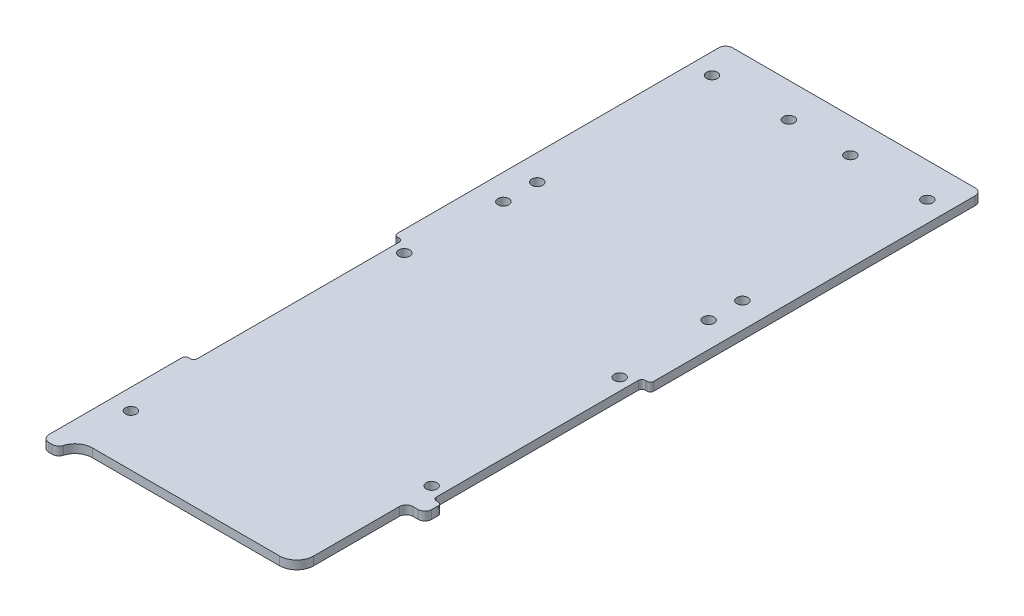
from build123d import *

# Parameters (mm, degrees)
SKETCH1_R               = 2.032
BOSS_EXTRUDE1_DEPTH     = 3.175
FILLET1_R               = 2.54
FILLET2_R               = 2.54
FILLET3_R               = 6.35
CUT_EXTRUDE1_DEPTH      = 136.673215063
FILLET4_R               = 6.35
FILLET5_R               = 2.54
SKETCH3_R               = 2.032
CUT_EXTRUDE2_DEPTH      = 136.673215063
CUT_EXTRUDE3_DEPTH      = 136.673215063
CUT_EXTRUDE3_DEPTH_BACK = 136.673215063
SKETCH4_W               = 3.175
SKETCH4_H               = 77.591904842
FILLET6_R               = 1.27


with BuildPart() as part:
    # Sketch1 → Boss-Extrude1 (new body)
    with BuildSketch(Plane(origin=(0, 0, 0), x_dir=(1, 0, 0), z_dir=(0, 1, 0))):
        Polygon((47.625, 127), (-47.625, 127), (-47.625, -127), (-41.275, -127), (-41.275, -120.65), (41.275, -120.65), (41.275, -127), (47.625, -127), align=None)
        with Locations((-39.999684148, -101.6)):
            Circle(SKETCH1_R, mode=Mode.SUBTRACT)
        with Locations((39.999684148, -69.85)):
            Circle(SKETCH1_R, mode=Mode.SUBTRACT)
        with Locations((-39.999684148, 0)):
            Circle(SKETCH1_R, mode=Mode.SUBTRACT)
        with Locations((-39.999684148, 114.3)):
            Circle(SKETCH1_R, mode=Mode.SUBTRACT)
        with Locations((-11.424684148, 114.3)):
            Circle(SKETCH1_R, mode=Mode.SUBTRACT)
        with Locations((39.999684148, 0)):
            Circle(SKETCH1_R, mode=Mode.SUBTRACT)
        with Locations((11.424684148, 114.3)):
            Circle(SKETCH1_R, mode=Mode.SUBTRACT)
        with Locations((39.999684148, 114.3)):
            Circle(SKETCH1_R, mode=Mode.SUBTRACT)
    extrude(amount=BOSS_EXTRUDE1_DEPTH)

    # Fillet1
    fillet1_edges = [part.edges().sort_by_distance(p)[0] for p in [
        (-47.625, 1.5875, -127),
        (47.625, 1.5875, -127),
        (47.625, 1.5875, 127),
        (-47.625, 1.5875, 127),
    ]]
    fillet(fillet1_edges, radius=FILLET1_R)

    # Fillet2
    fillet2_edges = [part.edges().sort_by_distance(p)[0] for p in [
        (41.275, 1.5875, 127),
        (-41.275, 1.5875, 127),
    ]]
    fillet(fillet2_edges, radius=FILLET2_R)

    # Fillet3
    fillet3_edges = [part.edges().sort_by_distance(p)[0] for p in [
        (41.275, 1.5875, 120.65),
        (-41.275, 1.5875, 120.65),
    ]]
    fillet(fillet3_edges, radius=FILLET3_R)

    # Sketch2 → Cut-Extrude1 (cut, through all)
    with BuildSketch(Plane.XZ):
        with BuildLine():
            Line((47.625, 131.883089137), (41.911715189, 131.883089137))
            Line((41.911715189, 131.883089137), (41.911715189, 126.141994925))
            ThreePointArc((41.911715189, 126.141994925), (41.594214629, 125.692766131), (41.380880287, 125.185714286))
            ThreePointArc((41.380880287, 125.185714286), (41.067866435, 124.353640062), (40.641715189, 123.573434767))
            Line((40.641715189, 123.573434767), (40.641715189, 79.981419179))
            Line((40.641715189, 79.981419179), (47.625, 79.981419179))
            Line((47.625, 79.981419179), (47.625, 131.883089137))
        make_face()
    extrude(amount=-CUT_EXTRUDE1_DEPTH, mode=Mode.SUBTRACT)

    # Fillet4
    fillet4_edges = [part.edges().sort_by_distance(p)[0] for p in [
        (40.641715189, 1.5875, 123.573434767),
    ]]
    fillet(fillet4_edges, radius=FILLET4_R)

    # Fillet5
    fillet5_edges = [part.edges().sort_by_distance(p)[0] for p in [
        (47.625, 1.5875, 79.981419179),
        (40.641715189, 1.5875, 79.981419179),
    ]]
    fillet(fillet5_edges, radius=FILLET5_R)

    # Sketch3 → Cut-Extrude2 (cut, through all)
    with BuildSketch(Plane.XZ):
        with Locations((-38.112208237, -34.913768806)):
            Circle(SKETCH3_R)
        with Locations((-38.112208237, -47.490173279)):
            Circle(SKETCH3_R)
        with Locations((38.112208237, -47.490173279)):
            Circle(SKETCH3_R)
        with Locations((38.112208237, -34.913768806)):
            Circle(SKETCH3_R)
    extrude(amount=-CUT_EXTRUDE2_DEPTH, mode=Mode.SUBTRACT)

    # Sketch4 → Cut-Extrude3 (cut, two sides: drawn at the far end of the back side and taken through both)
    with BuildSketch(Plane(origin=(0, 3.175, 0), x_dir=(1, 0, 0), z_dir=(0, 1, 0)).offset(-CUT_EXTRUDE3_DEPTH_BACK)):
        with Locations((-46.0375, -34.985952421)):
            Rectangle(SKETCH4_W, SKETCH4_H)
        with Locations((46.0375, -34.985952421)):
            Rectangle(SKETCH4_W, SKETCH4_H)
    extrude(amount=CUT_EXTRUDE3_DEPTH + CUT_EXTRUDE3_DEPTH_BACK, mode=Mode.SUBTRACT)

    # Fillet6
    fillet6_edges = [part.edges().sort_by_distance(p)[0] for p in [
        (-44.45, 1.5875, -3.81),
        (-44.45, 1.5875, 73.781904842),
        (44.45, 1.5875, -3.81),
        (44.45, 1.5875, 73.781904842),
        (47.625, 1.5875, 73.781904842),
        (47.625, 1.5875, -3.81),
        (-47.625, 1.5875, 73.781904842),
        (-47.625, 1.5875, -3.81),
    ]]
    fillet(fillet6_edges, radius=FILLET6_R)


solid = part.part
